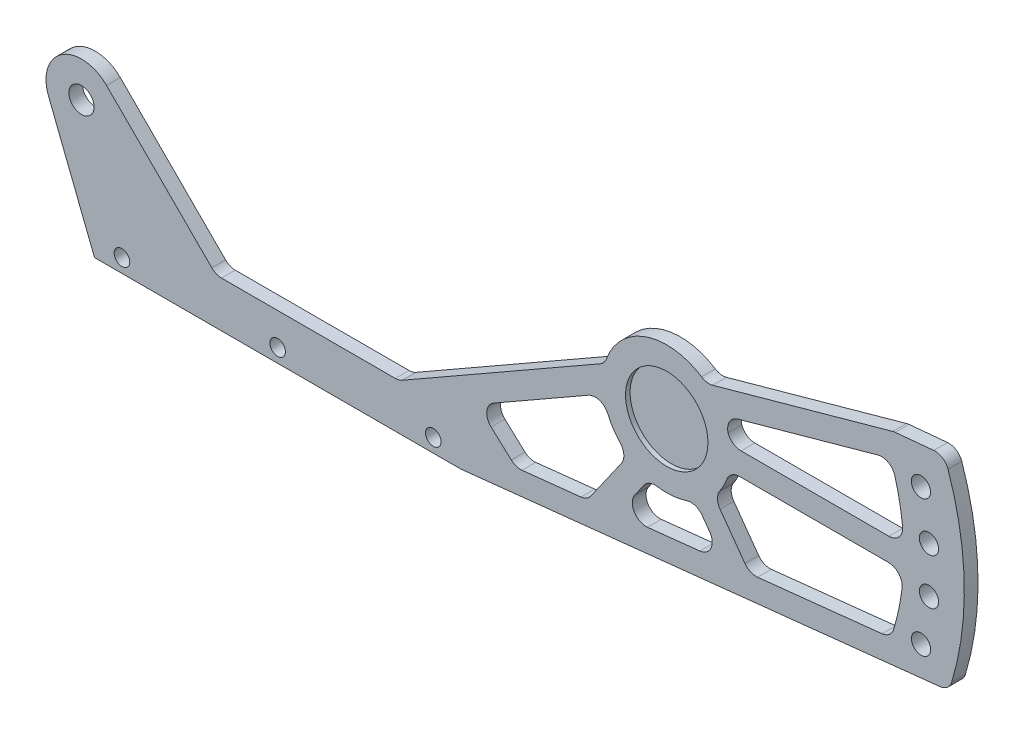
from build123d import *

# Parameters (mm, degrees)
EXTRUDE_1_DEPTH     = 3
HOLE_WIZARD_M31_D   = 3.4
SKETCH_5_R          = 2.749999999999999
EXTRUDE_2_DEPTH     = 3
CUT_EXTRUDE_1_DEPTH = 198.9348007797117
M5X0_81_D           = 4.2
CUT_EXTRUDE_2_DEPTH = 198.9348007797117
CUT_EXTRUDE_3_DEPTH = 198.9348007797117
FILLET_1_R          = 3
SKETCH_12_R         = 8.999999999999996
CUT_EXTRUDE_4_DEPTH = 1


with BuildPart() as part:
    # Эскиз1 → Бобышка-Вытянуть1 (new body)
    with BuildSketch(Plane.XY):
        with BuildLine():
            Line((0, 0), (80, 0))
            Line((80, 0), (186.64735263363326, 11.394080625595256))
            ThreePointArc((186.64735263363326, 11.394080625595256), (189.98303763522418, 33.48486352875775), (185.64181138843185, 55.40022887772366))
            Line((185.64181138843185, 55.40022887772366), (29.81788185582472, 40.959090919498855))
            Line((29.81788185582472, 40.959090919498855), (1.6e-16, 40.959090919498855))
            Line((1.6e-16, 40.959090919498855), (0, 0))
        make_face()
    extrude(amount=EXTRUDE_1_DEPTH)

    # Отверстие с зазором M31 (through all)
    with Locations(Plane.XY.offset(3)):
        with Locations((6, 3), (40, 3), (74, 3)):
            Hole(HOLE_WIZARD_M31_D / 2)

    # Эскиз5 → Бобышка-Вытянуть2 (add)
    with BuildSketch(Plane.XY.offset(3)):
        with BuildLine():
            Line((-10.05858051013897, 25.55645888767347), (0, 0))
            Line((0, 0), (0, 21.18668565496398))
            ThreePointArc((0, 21.18668565496398), (0.24099496955508215, 35.503000018294074), (-10.05858051013897, 25.55645888767347))
        make_face()
        with Locations((-2.8470386460772503, 28.39479712384004)):
            Circle(SKETCH_5_R, mode=Mode.SUBTRACT)
    extrude(amount=-EXTRUDE_2_DEPTH)

    # Эскиз6 → Вырез-Вытянуть1 (cut, through all)
    with BuildSketch(Plane.XY.offset(3)):
        with BuildLine():
            Line((2.6330389081184924, 33.874874678035766), (26.507913586154185, 10.000000000000002))
            Line((26.507913586154185, 10.000000000000002), (66.50791358615419, 10))
            Line((66.50791358615419, 10), (104.37682925914895, 47.8689156729949))
            Line((104.37682925914895, 47.8689156729949), (29.817881855824798, 40.95909091949886))
            Line((29.817881855824798, 40.95909091949886), (1.6e-16, 40.959090919498855))
            Line((1.6e-16, 40.959090919498855), (0, 35.60290859271609))
            ThreePointArc((0, 35.60290859271609), (1.4052244403019993, 34.874053149358424), (2.6330389081184924, 33.874874678035766))
        make_face()
    extrude(amount=-CUT_EXTRUDE_1_DEPTH, mode=Mode.SUBTRACT)

    # Отверстие обработанное метчиком M5x0.81 (through all)
    with Locations(Plane.XY.offset(3)):
        with Locations((180.527942872, 46.929754199), (182.276873258, 37.060611597), (182.285474835, 27.037704871), (180.553486246, 17.165574973)):
            Hole(M5X0_81_D / 2)

    # Эскиз10 → Вырез-Вытянуть2 (cut, through all)
    with BuildSketch(Plane.XY.offset(3)):
        with BuildLine():
            Line((66.50791358615419, 10), (111.50918528954904, 35.741379217384946))
            ThreePointArc((111.50918528954904, 35.741379217384946), (120.64604118056285, 45.30575223723353), (133.66945767503876, 42.9927477739058))
            Line((133.66945767503876, 42.9927477739058), (174.65262323365093, 54.38179491403086))
            Line((174.65262323365093, 54.38179491403086), (104.37682925914895, 47.8689156729949))
            Line((104.37682925914895, 47.8689156729949), (66.50791358615419, 10))
        make_face()
    extrude(amount=-CUT_EXTRUDE_2_DEPTH, mode=Mode.SUBTRACT)

    # Эскиз11 → Вырез-Вытянуть3 (cut, through all)
    with BuildSketch(Plane.XY.offset(3)):
        with BuildLine():
            Line((92.03441017428995, 6.314197935775633), (107.63021765734568, 7.980436088856215))
            Line((107.63021765734568, 7.980436088856215), (116.60825973560767, 20.79380995453953))
            ThreePointArc((116.60825973560767, 20.79380995453953), (113.01565006615179, 24.762917945534056), (111.17548635848748, 29.790289028937345))
            Line((111.17548635848748, 29.790289028937345), (83.6237542782258, 14.03029921690936))
            Line((83.6237542782258, 14.03029921690936), (92.03441017428995, 6.314197935775633))
        make_face()
        with BuildLine():
            Line((173.93078584223207, 48.99172434981097), (137.24012127463044, 38.79554495109394))
            ThreePointArc((137.24012127463044, 38.79554495109394), (138.25871477406997, 36.49516212609262), (138.84915367150305, 34.04962010701802))
            Line((138.84915367150305, 34.04962010701802), (176.75654119949715, 34.04962010701802))
            ThreePointArc((176.75654119949715, 34.04962010701802), (175.8950005059697, 41.62493755905363), (173.93078584223207, 48.99172434981097))
        make_face()
        with BuildLine():
            Line((121.13678636305278, 18.543567322826398), (114.22945460790407, 8.685490982627265))
            Line((114.22945460790407, 8.685490982627265), (137.37877384972535, 11.158737653597806))
            Line((137.37877384972535, 11.158737653597806), (131.35012272889716, 19.52298347648991))
            ThreePointArc((131.35012272889716, 19.52298347648991), (126.33641056880738, 18.063931444213534), (121.13678636305278, 18.543567322826398))
        make_face()
        with BuildLine():
            Line((143.10149490164468, 11.770146595809063), (173.95081110549165, 15.066052095485405))
            ThreePointArc((173.95081110549165, 15.066052095485405), (175.8152185482702, 21.96236763923512), (176.7130134299426, 29.049620107018022))
            Line((176.7130134299426, 29.049620107018022), (138.68558579261725, 29.049620107018022))
            ThreePointArc((138.68558579261725, 29.049620107018022), (137.43996226457978, 25.57759088380138), (135.33074101249935, 22.551413326181333))
            Line((135.33074101249935, 22.551413326181333), (143.10149490164468, 11.770146595809063))
        make_face()
    extrude(amount=-CUT_EXTRUDE_3_DEPTH, mode=Mode.SUBTRACT)

    # Скругление1
    # the kernel refuses this fillet: 3 mm, written as the material it adds along each edge
    with BuildSketch(Plane(origin=(133.66945767503876, 42.992747773905805, 3), x_dir=(-0.8130725400087585, 0.5821623868678788, 0), z_dir=(0, 0, -1))) as fillet_1_piece_1:
        with BuildLine():
            CenterArc((1.4378103136794376, 2.996771470104822), FILLET_1_R, 218.86683700391524, 48.47477501487009)
            Line((-0.8980091423480934, 1.1142339621535844), (0, 0))
            ThreePointArc((0, 0), (0.6493336900487631, 0.01506647284415901), (1.2986673800975244, 0))
        make_face()
    extrude(amount=3)
    with BuildSketch(Plane(origin=(111.50918528954904, 35.741379217384946, 3), x_dir=(-0.8680239741683529, -0.49652228577273216, 0), z_dir=(0, 0, -1))) as fillet_1_piece_2:
        with BuildLine():
            CenterArc((1.16542958022559, 2.9999999999999964), FILLET_1_R, 229.5997180782211, 40.4002819217792)
            ThreePointArc((-0.7789413643040896, 0.7153946445679564), (-0.382712836911811, 0.3650554500406897), (0, 0))
            Line((0, 0), (1.165429580225606, 1e-17))
        make_face()
    extrude(amount=3)
    with BuildSketch(Plane(origin=(92.03441017428995, 6.314197935775633, 3), x_dir=(0.9943411291859616, 0.10623426381910231, 0), z_dir=(0, 0, -1))) as fillet_1_piece_3:
        with BuildLine():
            CenterArc((FILLET_1_R * 0.451855277113, -FILLET_1_R), FILLET_1_R, 89.9999999999999, 48.632165419305906)
            Line((-FILLET_1_R * 0.298626929798, -FILLET_1_R * 0.339109345572), (0, 0))
            Line((0, 0), (FILLET_1_R * 0.451855277113, -1e-17))
        make_face()
    extrude(amount=3)
    with BuildSketch(Plane(origin=(83.6237542782258, 14.03029921690936, 3), x_dir=(0.8680239741683552, 0.496522285772728, 0), z_dir=(0, 0, -1))) as fillet_1_piece_4:
        with BuildLine():
            CenterArc((FILLET_1_R * 1.36872958736, FILLET_1_R), FILLET_1_R, 162.30406475526607, 107.69593524473399)
            Line((FILLET_1_R * 0.416046539376, FILLET_1_R * 1.30396547515), (0, 0))
            Line((0, 0), (FILLET_1_R * 1.36872958736, -5e-17))
        make_face()
    extrude(amount=3)
    with BuildSketch(Plane(origin=(111.17548635848748, 29.790289028937345, 3), x_dir=(0.2779694371109165, -0.960589918764631, 0), z_dir=(0, 0, -1))) as fillet_1_piece_5:
        with BuildLine():
            CenterArc((3.8089394275276667, 2.977268689428244), FILLET_1_R, 166.36886991345514, 96.57341947464624)
            Line((0.893440130163459, 3.684279189398942), (0, 0))
            ThreePointArc((0, 0), (1.720166193077011, 0.10607944933485743), (3.4403323861540267, -8e-17))
        make_face()
    extrude(amount=3)
    with BuildSketch(Plane(origin=(116.60825973560767, 20.79380995453953, 3), x_dir=(-0.5738346401441979, -0.8189711873873091, 0), z_dir=(0, 0, -1))) as fillet_1_piece_6:
        with BuildLine():
            CenterArc((2.6548645047083914, 3.0000000000000018), FILLET_1_R, 191.68179125859942, 78.31820874140055)
            ThreePointArc((-0.28299711772598396, 2.392571742979232), (-0.08993594197380265, 1.2023847782433434), (0, 0))
            Line((0, 0), (2.654864504708389, 0))
        make_face()
    extrude(amount=3)
    with BuildSketch(Plane(origin=(107.63021765734568, 7.980436088856215, 3), x_dir=(-0.9943411291859616, -0.10623426381910264, 0), z_dir=(0, 0, -1))) as fillet_1_piece_7:
        with BuildLine():
            CenterArc((FILLET_1_R * 0.4545006609, FILLET_1_R), FILLET_1_R, 221.11634455075327, 48.883655449246646)
            Line((-FILLET_1_R * 0.298875173788, FILLET_1_R * 0.342409814772), (0, 0))
            Line((0, 0), (FILLET_1_R * 0.4545006609, 0))
        make_face()
    extrude(amount=3)
    with BuildSketch(Plane(origin=(137.37877384972535, 11.158737653597806, 3), x_dir=(-0.9943411291859617, -0.10623426381910242, 0), z_dir=(0, 0, -1))) as fillet_1_piece_8:
        with BuildLine():
            CenterArc((FILLET_1_R * 1.72108797237, FILLET_1_R), FILLET_1_R, 150.3155592750541, 119.68444072494606)
            Line((FILLET_1_R * 0.852321942917, FILLET_1_R * 1.49522276409), (0, 0))
            Line((0, 0), (FILLET_1_R * 1.72108797237, -6e-17))
        make_face()
    extrude(amount=3)
    with BuildSketch(Plane(origin=(114.22945460790407, 8.685490982627265, 3), x_dir=(0.5738346401441975, 0.8189711873873095, 0), z_dir=(0, 0, -1))) as fillet_1_piece_9:
        with BuildLine():
            CenterArc((FILLET_1_R * 2.20021682261, FILLET_1_R), FILLET_1_R, 138.8836554492469, 131.11634455075307)
            Line((FILLET_1_R * 1.44684098792, FILLET_1_R * 1.65759018523), (0, 0))
            Line((0, 0), (FILLET_1_R * 2.20021682261, 2e-17))
        make_face()
    extrude(amount=3)
    with BuildSketch(Plane(origin=(121.13678636305278, 18.543567322826398, 3), x_dir=(-0.5738346401441984, -0.8189711873873087, 0), z_dir=(0, 0, -1))) as fillet_1_piece_10:
        with BuildLine():
            CenterArc((1.990265982493936, -3.0000000000000013), FILLET_1_R, 89.99999999999993, 63.60335445318877)
            ThreePointArc((-0.6969473887897009, -1.666251786432529), (-0.32157533753284756, -0.844376737614642), (0, 0))
            Line((0, 0), (1.9902659824939402, 5e-17))
        make_face()
    extrude(amount=3)
    with BuildSketch(Plane(origin=(131.35012272889716, 19.522983476489905, 3), x_dir=(0.5847130820131278, -0.8112401689528875, 0), z_dir=(0, 0, -1))) as fillet_1_piece_11:
        with BuildLine():
            CenterArc((2.3682065417982856, 3.0000000000000004), FILLET_1_R, 197.6131255819165, 72.3868744180835)
            ThreePointArc((-0.4911575816723561, 2.0922352675891354), (-0.20537262369653822, 1.0555561343908344), (0, 0))
            Line((0, 0), (2.368206541798286, 1e-17))
        make_face()
    extrude(amount=3)
    with BuildSketch(Plane(origin=(173.93078584223207, 48.99172434981097, 3), x_dir=(-0.9634885943550286, -0.26774937637232876, 0), z_dir=(0, 0, -1))) as fillet_1_piece_12:
        with BuildLine():
            CenterArc((2.897416461846995, -3.0000000000000013), FILLET_1_R, 90.00000000000013, 89.6828037551533)
            ThreePointArc((-0.1025375653525866, -2.9833917282944458), (-0.07276547265506263, -1.4909570345015974), (0, 0))
            Line((0, 0), (2.8974164618469884, -5e-17))
        make_face()
    extrude(amount=3)
    with BuildSketch(Plane(origin=(176.75654119949715, 34.04962010701802, 3), x_dir=(-1, 0, 0), z_dir=(0, 0, -1))) as fillet_1_piece_13:
        with BuildLine():
            CenterArc((3.221407714928148, 3), FILLET_1_R, 174.06028761643057, 95.93971238356943)
            ThreePointArc((0.23751372052348074, 3.310445857043881), (0.09223500645424565, 1.6571257852503223), (0, 0))
            Line((0, 0), (3.221407714928148, 0))
        make_face()
    extrude(amount=3)
    with BuildSketch(Plane(origin=(138.84915367150305, 34.04962010701802, 3), x_dir=(-0.22238352713061194, 0.9749592642059198, 0), z_dir=(0, 0, -1))) as fillet_1_piece_14:
        with BuildLine():
            CenterArc((2.394810958848804, 2.9910348047399777), FILLET_1_R, 192.84906769128517, 72.72030630224907)
            Line((-0.5300668337689619, 2.32388422334817), (0, 0))
            ThreePointArc((0, 0), (1.081527529802683, 0.04183757788016305), (2.163055059605388, 0))
        make_face()
    extrude(amount=3)
    with BuildSketch(Plane(origin=(137.24012127463044, 38.79554495109394, 3), x_dir=(0.9634885943550292, 0.2677493763723269, 0), z_dir=(0, 0, -1))) as fillet_1_piece_15:
        with BuildLine():
            CenterArc((3.3851332754644625, 3.0000000000000013), FILLET_1_R, 179.08948046092507, 90.91051953907493)
            ThreePointArc((0.3855120801952658, 3.047672684965048), (0.27660128884680796, 1.5132304278712665), (0, 0))
            Line((0, 0), (3.3851332754644634, 6e-17))
        make_face()
    extrude(amount=3)
    with BuildSketch(Plane(origin=(143.10149490164468, 11.770146595809063, 3), x_dir=(0.9943411291859617, 0.10623426381910227, 0), z_dir=(0, 0, -1))) as fillet_1_piece_16:
        with BuildLine():
            CenterArc((FILLET_1_R * 0.581027824292, -FILLET_1_R), FILLET_1_R, 90.00000000000017, 60.3155592750542)
            Line((-FILLET_1_R * 0.287738205159, -FILLET_1_R * 0.50477723591), (0, 0))
            Line((0, 0), (FILLET_1_R * 0.581027824292, -1e-17))
        make_face()
    extrude(amount=3)
    with BuildSketch(Plane(origin=(135.33074101249935, 22.551413326181333, 3), x_dir=(0.6191906205716086, 0.7852407117541386, 0), z_dir=(0, 0, -1))) as fillet_1_piece_17:
        with BuildLine():
            CenterArc((2.264587612579221, 2.9919845725048013), FILLET_1_R, 195.96022348085205, 69.85051867741447)
            Line((-0.6197708484362799, 2.1670747178126035), (0, 0))
            ThreePointArc((0, 0), (1.0227169863260859, 0.03740532831092148), (2.0454339726521837, 5e-17))
        make_face()
    extrude(amount=3)
    with BuildSketch(Plane(origin=(138.68558579261725, 29.049620107018022, 3), x_dir=(1, 0, 0), z_dir=(0, 0, -1))) as fillet_1_piece_18:
        with BuildLine():
            CenterArc((2.239017157823781, 3), FILLET_1_R, 200.4886819411101, 69.51131805888991)
            ThreePointArc((-0.5712068922540539, 1.9499329600620143), (-0.2501815737843174, 0.9853428458000373), (0, 0))
            Line((0, 0), (2.239017157823781, 0))
        make_face()
    extrude(amount=3)
    with BuildSketch(Plane(origin=(176.7130134299426, 29.049620107018022, 3), x_dir=(-0.08949841173945887, -0.9959869649227917, 0), z_dir=(0, 0, -1))) as fillet_1_piece_19:
        with BuildLine():
            CenterArc((3.2815211967518683, 2.998403344451645), FILLET_1_R, 174.86524824854192, 97.00415022459947)
            Line((0.29356030198349303, 3.266898579670022), (0, 0))
            ThreePointArc((0, 0), (1.6896926532610193, -0.02756738048459419), (3.37938530652206, -2e-17))
        make_face()
    extrude(amount=3)
    with BuildSketch(Plane(origin=(173.95081110549165, 15.066052095485404, 3), x_dir=(-0.994341129185962, -0.1062342638191007, 0), z_dir=(0, 0, -1))) as fillet_1_piece_20:
        with BuildLine():
            CenterArc((1.944914405279492, 2.9999999999999996), FILLET_1_R, 202.9640654934915, 67.03593450650857)
            ThreePointArc((-0.8173347828283964, 1.8295387991063596), (-0.41751534735678364, 0.9108166317013427), (0, 0))
            Line((0, 0), (1.944914405279496, -1e-17))
        make_face()
    extrude(amount=3)
    with BuildSketch(Plane(origin=(66.50791358615419, 10, 3), x_dir=(-1, 0, 0), z_dir=(0, 0, -1))) as fillet_1_piece_21:
        with BuildLine():
            CenterArc((FILLET_1_R * 0.265800810182, FILLET_1_R), FILLET_1_R, 240.229818231195, 29.770181768805003)
            Line((-FILLET_1_R * 0.230721475591, FILLET_1_R * 0.131976025832), (0, 0))
            Line((0, 0), (FILLET_1_R * 0.265800810182, 0))
        make_face()
    extrude(amount=3)
    with BuildSketch(Plane(origin=(26.507913586154185, 10.000000000000002, 3), x_dir=(-0.7071067811865482, 0.7071067811865468, 0), z_dir=(0, 0, -1))) as fillet_1_piece_22:
        with BuildLine():
            CenterArc((FILLET_1_R * 0.414213562373, FILLET_1_R), FILLET_1_R, 225.00000000000006, 45.000000000000114)
            Line((-FILLET_1_R * 0.292893218813, FILLET_1_R * 0.292893218813), (0, 0))
            Line((0, 0), (FILLET_1_R * 0.414213562373, 1e-17))
        make_face()
    extrude(amount=3)
    # the kernel refuses this fillet: 3 mm, written as the material it takes off along each edge
    with BuildSketch(Plane(origin=(174.6526232336509, 54.381794914030856, 3.6717035747929345), x_dir=(-0.9634885943550205, -0.26774937637235796, 0), z_dir=(0, 0, -1))) as fillet_1_2_piece_1:
        with BuildLine():
            CenterArc((FILLET_1_R * 0.0895604766391, -FILLET_1_R), FILLET_1_R, 90.00000000000188, 10.235566175230105)
            Line((-FILLET_1_R * 0.0881351658569, -FILLET_1_R * 0.0159145064386), (0, 0))
            Line((0, 0), (FILLET_1_R * 0.0895604766391, -1e-17))
        make_face()
    extrude(amount=4.34340714958587, mode=Mode.SUBTRACT)
    with BuildSketch(Plane(origin=(185.64181138843185, 55.40022887772366, -5.916554139644239), x_dir=(0.3429596926027861, -0.9393501206950486, 0), z_dir=(0, 0, 1))) as fillet_1_2_piece_2:
        with BuildLine():
            CenterArc((2.312007309953282, -2.999502837675169), FILLET_1_R, 88.95688520370253, 76.28063656309585)
            Line((-0.5889640915743037, -2.2350651832395365), (0, 0))
            ThreePointArc((0, 0), (1.183310827928844, 0.010771850371206), (2.366621655857689, 6e-17))
        make_face()
    extrude(amount=14.833108279288478, mode=Mode.SUBTRACT)
    with BuildSketch(Plane(origin=(186.64735263363326, 11.394080625595256, -5.014960799028406), x_dir=(-0.9943411291859617, -0.10623426381910225, 0), z_dir=(0, 0, 1))) as fillet_1_2_piece_3:
        with BuildLine():
            CenterArc((1.9591455422097777, -2.9999999999999996), FILLET_1_R, 89.99999999999983, 67.1875610802881)
            ThreePointArc((-0.806191458360402, -1.8368528582859858), (-0.41018210878156197, -0.9153162297170893), (0, 0))
            Line((0, 0), (1.9591455422097865, 2e-17))
        make_face()
    extrude(amount=13.029921598056813, mode=Mode.SUBTRACT)

    # Эскиз12 → Вырез-Вытянуть4 (cut)
    with BuildSketch(Plane.XY.offset(3)):
        with Locations((124.99999999999999, 31.999999999999986)):
            Circle(SKETCH_12_R)
    extrude(amount=-CUT_EXTRUDE_4_DEPTH, mode=Mode.SUBTRACT)


solid = part.part
